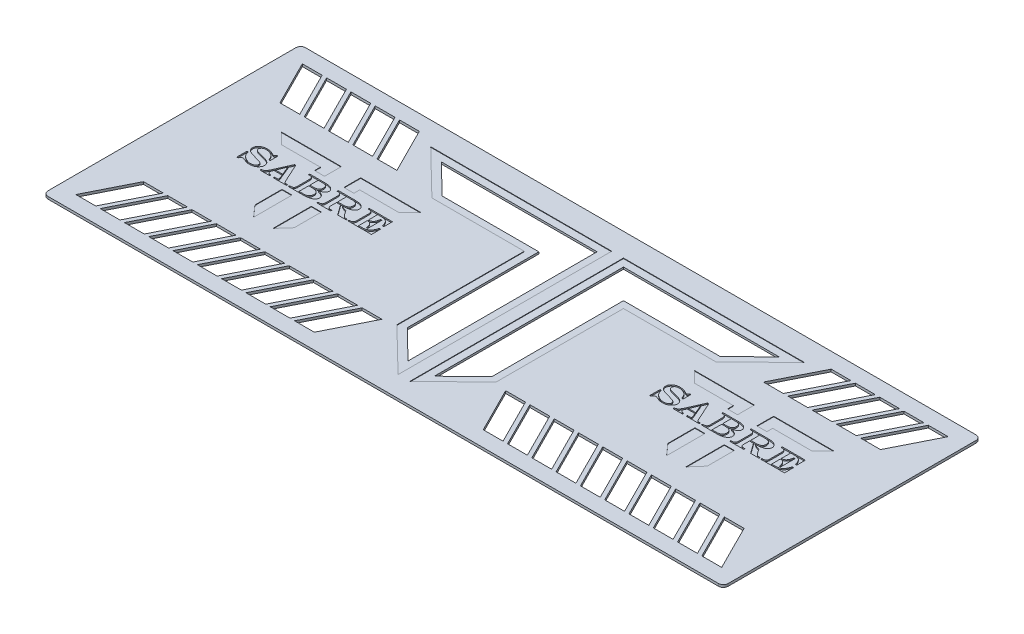
from build123d import *

# Parameters (mm, degrees)
SKETCH1_W           = 280
SKETCH1_H           = 106
BOSS_EXTRUDE1_DEPTH = 1
FILLET1_R           = 2
CUT_EXTRUDE1_START  = -0.5
CUT_EXTRUDE1_DEPTH  = 0.5
LPATTERN1_COUNT     = 2
LPATTERN1_PITCH     = 170
CUT_EXTRUDE2_DEPTH  = 1
CUT_EXTRUDE3_DEPTH  = 0.2
CUT_EXTRUDE4_DEPTH  = 0.2
CUT_EXTRUDE5_DEPTH  = 1


# Read off the part's stored shape, not the designer's step: Cut-Extrude1
with BuildPart() as part:
    # Sketch1 → Boss-Extrude1 (new body)
    with BuildSketch(Plane(origin=(0, 0, 0), x_dir=(1, 0, 0), z_dir=(0, 1, 0))):
        Rectangle(SKETCH1_W, SKETCH1_H)
    extrude(amount=BOSS_EXTRUDE1_DEPTH)

    # Fillet1
    fillet1_edges = [part.edges().sort_by_distance(p)[0] for p in [
        (-140, 0.5, -53),
        (140, 0.5, -53),
        (140, 0.5, 53),
        (-140, 0.5, 53),
    ]]
    fillet(fillet1_edges, radius=FILLET1_R)

    # Cut-Extrude1 outline → Cut-Extrude1 (cut)
    # profile 1 of 5: a face of its own
    with BuildSketch(Plane(origin=(0, 1, 0), x_dir=(1, 0, 0), z_dir=(0, 1, 0)).offset(CUT_EXTRUDE1_START)):
        with BuildLine():
            add(Edge.make_bspline(
                [(-106.17746632, 8.000768713), (-106.145436657, 8.002877246), (-106.081432034, 8.007090709), (-105.989368542, 8.043217945), (-105.903951635, 8.100887742), (-105.825090229, 8.181376258), (-105.752575803, 8.283783991), (-105.685428408, 8.407716897), (-105.626681677, 8.554887696), (-105.592757947, 8.661047453), (-105.574796476, 8.717255463)],
                knots=[0, 0, 0, 0, 0.095615682, 0.191068058, 0.291769804, 0.402365532, 0.526393257, 0.666376207, 0.823357453, 1, 1, 1, 1], degree=3))
            add(Edge.make_bspline(
                [(-106.791331271, 8.252658586), (-106.751620071, 8.232566304), (-106.676905456, 8.194763692), (-106.569734296, 8.144105729), (-106.475030396, 8.101534587), (-106.392563884, 8.065441605), (-106.321624886, 8.037374546), (-106.262815847, 8.016420153), (-106.215885923, 8.004136854), (-106.18870146, 8.001753667), (-106.17746632, 8.000768713)],
                knots=[0, 0, 0, 0, 0.200425727, 0.377090874, 0.533798689, 0.668043957, 0.782475738, 0.877256726, 0.949271104, 1, 1, 1, 1], degree=3))
            add(Edge.make_bspline(
                [(-109.823339004, 9.075498839), (-109.698843294, 9.072982106), (-109.448006616, 9.067911338), (-109.071678884, 9.026528515), (-108.693771902, 8.963979494), (-108.315088567, 8.873055465), (-107.934808536, 8.757744826), (-107.553228534, 8.614782269), (-107.170201992, 8.447014683), (-106.918807609, 8.318052406), (-106.791331271, 8.252658586)],
                knots=[0, 0, 0, 0, 0.117664495, 0.237072998, 0.357512053, 0.47958756, 0.604949098, 0.732946784, 0.864583425, 1, 1, 1, 1], degree=3))
            add(Edge.make_bspline(
                [(-113.262102235, 6.424124692), (-113.260506248, 6.486989147), (-113.257337483, 6.611803854), (-113.236933912, 6.796647021), (-113.201038024, 6.97615715), (-113.152537496, 7.150243497), (-113.090616573, 7.319521153), (-113.014308504, 7.483966342), (-112.921590044, 7.642733737), (-112.817948383, 7.797516049), (-112.700485911, 7.944690273), (-112.570769337, 8.082483965), (-112.432328098, 8.21467904), (-112.281368009, 8.336662791), (-112.120466803, 8.451562573), (-111.947984157, 8.5550332), (-111.766513978, 8.653694535), (-111.507168171, 8.76900699), (-111.166071546, 8.893862404), (-110.736287433, 8.998963158), (-110.286246275, 9.064852534), (-109.979681393, 9.071903154), (-109.823339004, 9.075498839)],
                knots=[0, 0, 0, 0, 0.038971493, 0.077376244, 0.115107398, 0.152338832, 0.189297768, 0.226728302, 0.264555857, 0.303159433, 0.342117573, 0.381127191, 0.420400756, 0.460685165, 0.501336906, 0.542862355, 0.585296084, 0.629298266, 0.718697782, 0.810057838, 0.903133029, 1, 1, 1, 1], degree=3))
            add(Edge.make_bspline(
                [(-112.857212587, 5.252370319), (-112.919502528, 5.341302903), (-113.041993357, 5.516185489), (-113.168384559, 5.807447711), (-113.246814723, 6.111513379), (-113.256969271, 6.319161717), (-113.262102235, 6.424124692)],
                knots=[0, 0, 0, 0, 0.257658078, 0.506674932, 0.750631924, 1, 1, 1, 1], degree=3))
            add(Edge.make_bspline(
                [(-111.207800381, 4.186969448), (-111.308804399, 4.225506907), (-111.500911414, 4.298804152), (-111.771038249, 4.413323202), (-112.005759391, 4.531277493), (-112.213304283, 4.647887874), (-112.396772773, 4.77549482), (-112.563393385, 4.918769347), (-112.719090354, 5.076743176), (-112.8110049, 5.193615664), (-112.857212587, 5.252370319)],
                knots=[0, 0, 0, 0, 0.162597773, 0.309256734, 0.441034827, 0.557526682, 0.667037542, 0.776516434, 0.887649353, 1, 1, 1, 1], degree=3))
            add(Edge.make_bspline(
                [(-109.250522773, 3.588031305), (-109.36431422, 3.619838501), (-109.582598995, 3.680853865), (-109.89681424, 3.767178616), (-110.181565483, 3.852421101), (-110.440338233, 3.927968472), (-110.670982293, 4.000576368), (-110.873957966, 4.068337028), (-111.050870417, 4.126830334), (-111.158173389, 4.167951261), (-111.207800381, 4.186969448)],
                knots=[0, 0, 0, 0, 0.17311511, 0.332084649, 0.477412506, 0.608598903, 0.727051977, 0.831656342, 0.92214205, 1, 1, 1, 1], degree=3))
            Line((-109.250522773, 3.588031305), (-108.632926121, 3.423836425))
            add(Edge.make_bspline(
                [(-106.328600244, 2.511435328), (-106.388553059, 2.563492991), (-106.518554848, 2.676374918), (-106.718225964, 2.781418153), (-106.90109941, 2.872530925), (-107.065475263, 2.939437603), (-107.248371304, 3.01134221), (-107.455287809, 3.082671874), (-107.693272056, 3.158020074), (-107.968366193, 3.242321333), (-108.286585003, 3.331271031), (-108.512825256, 3.391737481), (-108.632926121, 3.423836425)],
                knots=[0, 0, 0, 0, 0.095058532, 0.206125086, 0.269252981, 0.340546635, 0.419045255, 0.505254492, 0.603271131, 0.718797856, 0.850722316, 1, 1, 1, 1], degree=3))
            add(Edge.make_bspline(
                [(-105.987149527, 1.763229112), (-105.990692876, 1.831002763), (-105.997786932, 1.966690814), (-106.068928207, 2.162123203), (-106.175479105, 2.349373457), (-106.276338616, 2.456122147), (-106.328600244, 2.511435328)],
                knots=[0, 0, 0, 0, 0.239838849, 0.480175786, 0.730646522, 1, 1, 1, 1], degree=3))
            add(Edge.make_bspline(
                [(-108.019061171, 0.358243375), (-107.925032063, 0.360178707), (-107.740010042, 0.363986879), (-107.470151601, 0.400235493), (-107.213511019, 0.458424576), (-106.972436875, 0.537337747), (-106.75100623, 0.63752066), (-106.553246546, 0.754440186), (-106.383250778, 0.890260978), (-106.23974769, 1.041332704), (-106.12805021, 1.207731021), (-106.044846194, 1.383926047), (-105.997716973, 1.571109766), (-105.990686659, 1.698922992), (-105.987149527, 1.763229112)],
                knots=[0, 0, 0, 0, 0.102905249, 0.202487694, 0.297472894, 0.390713923, 0.479700354, 0.563083208, 0.641567444, 0.71720244, 0.790293303, 0.860063715, 0.929594457, 1, 1, 1, 1], degree=3))
            add(Edge.make_bspline(
                [(-111.77875076, 2.151326102), (-111.699914494, 2.065343867), (-111.540080634, 1.891022159), (-111.271150085, 1.652388665), (-110.981295724, 1.422719755), (-110.668151158, 1.211783786), (-110.34290088, 1.015767717), (-110.00797614, 0.847385831), (-109.671803532, 0.698243469), (-109.333166237, 0.576009836), (-108.99646247, 0.477144728), (-108.663891379, 0.412425293), (-108.339482913, 0.36484326), (-108.124960088, 0.360424628), (-108.019061171, 0.358243375)],
                knots=[0, 0, 0, 0, 0.081776267, 0.165794465, 0.25184825, 0.341026787, 0.430434453, 0.518036847, 0.603793757, 0.688252523, 0.77040959, 0.849636053, 0.925773031, 1, 1, 1, 1], degree=3))
            add(Edge.make_bspline(
                [(-112.59599346, 4.097408604), (-112.582159525, 4.002689945), (-112.554888771, 3.815971616), (-112.495598358, 3.542433483), (-112.416680293, 3.281636716), (-112.323053647, 3.031464713), (-112.213550659, 2.792743354), (-112.086230351, 2.566271951), (-111.94185754, 2.351701603), (-111.833286422, 2.218322769), (-111.77875076, 2.151326102)],
                knots=[0, 0, 0, 0, 0.134073388, 0.264298074, 0.391646335, 0.515443055, 0.638242392, 0.759173001, 0.879031733, 1, 1, 1, 1], degree=3))
            Line((-112.59599346, 4.097408604), (-113.152017032, 4.097408604))
            Line((-113.152017032, 4.097408604), (-113.152017032, -0.119414458))
            Line((-113.152017032, -0.119414458), (-112.607188565, -0.119414458))
            add(Edge.make_bspline(
                [(-111.666799705, 0.806047594), (-111.719859657, 0.803366984), (-111.823469237, 0.798132587), (-111.974741409, 0.761768959), (-112.115303186, 0.699384376), (-112.247501109, 0.612350872), (-112.368547463, 0.4905965), (-112.464500764, 0.323074105), (-112.549485835, 0.117568644), (-112.587026058, -0.036607746), (-112.607188565, -0.119414458)],
                knots=[0, 0, 0, 0, 0.109848072, 0.214499113, 0.320034099, 0.426842473, 0.540687667, 0.671896365, 0.823778573, 1, 1, 1, 1], degree=3))
            add(Edge.make_bspline(
                [(-110.474520972, 0.468328579), (-110.551409434, 0.500037753), (-110.694529193, 0.559061034), (-110.896488306, 0.632139688), (-111.065265438, 0.693984202), (-111.245953754, 0.746680503), (-111.44152737, 0.795690693), (-111.594350187, 0.802716726), (-111.666799705, 0.806047594)],
                knots=[0, 0, 0, 0, 0.200164531, 0.372585152, 0.516999432, 0.632577406, 0.825814033, 1, 1, 1, 1], degree=3))
            add(Edge.make_bspline(
                [(-108.047048935, -0.119414458), (-108.148481597, -0.11819611), (-108.348538042, -0.115793152), (-108.642493463, -0.090413374), (-108.925587003, -0.052243725), (-109.202927421, 0.005406581), (-109.488134874, 0.084535893), (-109.79322769, 0.188460664), (-110.126921543, 0.315021216), (-110.354946655, 0.415590797), (-110.474520972, 0.468328579)],
                knots=[0, 0, 0, 0, 0.120753913, 0.238163902, 0.35107058, 0.460731701, 0.575182342, 0.703288774, 0.844407304, 1, 1, 1, 1], degree=3))
            add(Edge.make_bspline(
                [(-105.177370231, 0.910535245), (-105.262521318, 0.828078956), (-105.433207954, 0.66279408), (-105.726880674, 0.453027248), (-106.049233888, 0.275925489), (-106.399535554, 0.13006291), (-106.776983097, 0.018702913), (-107.178625791, -0.060385941), (-107.604846985, -0.110102977), (-107.897018071, -0.116255247), (-108.047048935, -0.119414458)],
                knots=[0, 0, 0, 0, 0.113357576, 0.227226969, 0.34422936, 0.464878134, 0.589783684, 0.720342317, 0.856394812, 1, 1, 1, 1], degree=3))
            add(Edge.make_bspline(
                [(-104.416103059, 2.612191278), (-104.418774575, 2.538643159), (-104.424173238, 2.390015374), (-104.463834645, 2.166303958), (-104.525007957, 1.939758752), (-104.612921833, 1.713881874), (-104.722313929, 1.493532053), (-104.85081101, 1.28282304), (-105.002889015, 1.087382028), (-105.11893766, 0.969760028), (-105.177370231, 0.910535245)],
                knots=[0, 0, 0, 0, 0.11533341, 0.233068496, 0.355438412, 0.482999863, 0.612593659, 0.740943727, 0.869560528, 1, 1, 1, 1], degree=3))
            add(Edge.make_bspline(
                [(-105.141919064, 4.196298702), (-105.083132376, 4.138127892), (-104.968124578, 4.02432497), (-104.815318643, 3.841957898), (-104.692187265, 3.649395982), (-104.590580247, 3.452778839), (-104.510833636, 3.250497539), (-104.458131034, 3.042143885), (-104.422105989, 2.829251989), (-104.418119695, 2.68511107), (-104.416103059, 2.612191278)],
                knots=[0, 0, 0, 0, 0.138219231, 0.270406279, 0.396718167, 0.51947566, 0.639953373, 0.759231824, 0.878197213, 1, 1, 1, 1], degree=3))
            add(Edge.make_bspline(
                [(-107.991073407, 5.405370094), (-107.888996544, 5.378914954), (-107.691395429, 5.327702908), (-107.406228297, 5.248766396), (-107.140997833, 5.174494734), (-106.896562194, 5.102956682), (-106.674109449, 5.02870618), (-106.471702222, 4.960481212), (-106.289245043, 4.895951213), (-106.078636245, 4.809518012), (-105.839229163, 4.699461358), (-105.578314491, 4.549871606), (-105.344548063, 4.38469779), (-105.208440441, 4.258148521), (-105.141919064, 4.196298702)],
                knots=[0, 0, 0, 0, 0.101060651, 0.195633925, 0.283570652, 0.365043448, 0.439688609, 0.508301999, 0.569770025, 0.625115199, 0.726447956, 0.822045087, 0.913026136, 1, 1, 1, 1], degree=3))
            Line((-107.991073407, 5.405370094), (-108.476194645, 5.526650403))
            Line((-108.476194645, 5.526650403), (-108.787791747, 5.599418589))
            add(Edge.make_bspline(
                [(-109.073266937, 5.677784327), (-109.040999755, 5.667573999), (-108.982255569, 5.648985534), (-108.901651845, 5.627287961), (-108.839197041, 5.609518923), (-108.802758399, 5.602359301), (-108.787791747, 5.599418589)],
                knots=[0, 0, 0, 0, 0.342746122, 0.62398823, 0.845558529, 1, 1, 1, 1], degree=3))
            add(Edge.make_bspline(
                [(-111.37012941, 6.560331809), (-111.308787409, 6.506171455), (-111.179134143, 6.391697416), (-110.98517321, 6.27644248), (-110.803713608, 6.193270468), (-110.643943672, 6.127285955), (-110.463115887, 6.062830344), (-110.257699792, 5.996545029), (-110.01994979, 5.926593516), (-109.742911117, 5.850962405), (-109.422465142, 5.766870179), (-109.194585219, 5.708734493), (-109.073266937, 5.677784327)],
                knots=[0, 0, 0, 0, 0.098621157, 0.208446982, 0.27058147, 0.339592069, 0.417008968, 0.502239864, 0.600106632, 0.716123941, 0.848870602, 1, 1, 1, 1], degree=3))
            add(Edge.make_bspline(
                [(-111.623885134, 7.228306435), (-111.620678182, 7.161450397), (-111.614537356, 7.033431238), (-111.567212916, 6.851589891), (-111.487039418, 6.690724895), (-111.408921561, 6.603597807), (-111.37012941, 6.560331809)],
                knots=[0, 0, 0, 0, 0.273181187, 0.523100483, 0.763178887, 1, 1, 1, 1], degree=3))
            add(Edge.make_bspline(
                [(-111.261910057, 8.067939346), (-111.308531434, 8.013913637), (-111.407687147, 7.899010174), (-111.521843921, 7.694435264), (-111.606305758, 7.466963153), (-111.618107146, 7.306748113), (-111.623885134, 7.228306435)],
                knots=[0, 0, 0, 0, 0.228673321, 0.486349129, 0.74851527, 1, 1, 1, 1], degree=3))
            add(Edge.make_bspline(
                [(-109.83639996, 8.597841005), (-109.909222436, 8.596457117), (-110.050876467, 8.593765182), (-110.257626081, 8.571449741), (-110.451184605, 8.532532635), (-110.632717838, 8.478401494), (-110.80379866, 8.406355472), (-110.966258304, 8.31488994), (-111.120973484, 8.202058499), (-111.214349816, 8.113198991), (-111.261910057, 8.067939346)],
                knots=[0, 0, 0, 0, 0.13957811, 0.271506861, 0.398006454, 0.517573642, 0.634051402, 0.753100297, 0.874244264, 1, 1, 1, 1], degree=3))
            add(Edge.make_bspline(
                [(-106.46294151, 7.21711133), (-106.522742291, 7.283541231), (-106.644159959, 7.418418458), (-106.850878435, 7.602762549), (-107.080687658, 7.774997631), (-107.331055138, 7.93640734), (-107.601678957, 8.083644933), (-107.889870176, 8.214257433), (-108.194764224, 8.32816705), (-108.513486302, 8.423565431), (-108.840038673, 8.503287035), (-109.171495343, 8.555776949), (-109.503497897, 8.591501493), (-109.725599894, 8.59573102), (-109.83639996, 8.597841005)],
                knots=[0, 0, 0, 0, 0.071444271, 0.145058251, 0.221065176, 0.300954302, 0.38309134, 0.467237206, 0.553809308, 0.643191066, 0.733196278, 0.82241456, 0.911407917, 1, 1, 1, 1], degree=3))
            add(Edge.make_bspline(
                [(-105.571064774, 5.493065087), (-105.605584891, 5.585227494), (-105.672796217, 5.764669456), (-105.775991512, 6.024600685), (-105.885224653, 6.265372115), (-105.994303211, 6.490315151), (-106.108978971, 6.696493917), (-106.221424182, 6.888033802), (-106.339235796, 7.060269812), (-106.422565849, 7.165920647), (-106.46294151, 7.21711133)],
                knots=[0, 0, 0, 0, 0.151415398, 0.294808661, 0.43014741, 0.558099912, 0.679294196, 0.793016882, 0.89971109, 1, 1, 1, 1], degree=3))
            Line((-105.571064774, 5.493065087), (-105.029968009, 5.493065087))
            Line((-105.029968009, 5.493065087), (-105.029968009, 8.717255463))
            Line((-105.029968009, 8.717255463), (-105.574796476, 8.717255463))
        make_face()
    # profile 2 of 5: a face of its own
    with BuildSketch(Plane(origin=(0, 1, 0), x_dir=(1, 0, 0), z_dir=(0, 1, 0)).offset(CUT_EXTRUDE1_START)):
        with BuildLine():
            add(Edge.make_bspline(
                [(-94.590532153, 1.436705203), (-94.561384798, 1.376019374), (-94.505580421, 1.259832679), (-94.415035619, 1.099932497), (-94.322806366, 0.962519612), (-94.23188062, 0.845134406), (-94.137352013, 0.748811307), (-94.041504471, 0.6695629), (-93.944056296, 0.605358176), (-93.842728784, 0.555179827), (-93.734548299, 0.519750823), (-93.616810836, 0.495840353), (-93.488191647, 0.480970332), (-93.398295953, 0.478790148), (-93.351607147, 0.477657834)],
                knots=[0, 0, 0, 0, 0.12015059, 0.230035584, 0.327642723, 0.415374729, 0.494664926, 0.568012197, 0.636986209, 0.702524215, 0.769227226, 0.839554926, 0.916670216, 1, 1, 1, 1], degree=3))
            Line((-94.590532153, 1.436705203), (-98.089002614, 9.075498839))
            Line((-98.089002614, 9.075498839), (-98.574123852, 9.075498839))
            Line((-98.574123852, 9.075498839), (-101.363570966, 2.798776369))
            add(Edge.make_bspline(
                [(-102.606227674, 0.904937693), (-102.552348132, 0.949878678), (-102.439960308, 1.043621487), (-102.284417146, 1.212857033), (-102.126640081, 1.406973899), (-101.97370578, 1.632116158), (-101.817712682, 1.883051887), (-101.664269172, 2.162527667), (-101.510337613, 2.469920636), (-101.413713404, 2.686423675), (-101.363570966, 2.798776369)],
                knots=[0, 0, 0, 0, 0.092007693, 0.19191968, 0.301061643, 0.42018113, 0.548865169, 0.688823123, 0.838517001, 1, 1, 1, 1], degree=3))
            add(Edge.make_bspline(
                [(-103.76492109, 0.462731026), (-103.692099956, 0.47221376), (-103.556014446, 0.489934751), (-103.368498157, 0.521243672), (-103.213924749, 0.561676636), (-103.083283614, 0.602393705), (-102.967679299, 0.65922782), (-102.851794937, 0.726648474), (-102.730103877, 0.809617018), (-102.648819206, 0.872164218), (-102.606227674, 0.904937693)],
                knots=[0, 0, 0, 0, 0.174483929, 0.326069278, 0.4511396, 0.553933858, 0.650429054, 0.756361191, 0.872338166, 1, 1, 1, 1], degree=3))
            Line((-103.76492109, 0.462731026), (-103.76492109, 0))
            Line((-103.76492109, 0), (-99.783195243, 0))
            Line((-99.783195243, 0), (-99.783195243, 0.464596877))
            add(Edge.make_bspline(
                [(-100.604169645, 0.645584416), (-100.575017132, 0.629284066), (-100.520862559, 0.599004055), (-100.44490841, 0.559022319), (-100.37867593, 0.53087917), (-100.314584356, 0.507448349), (-100.23279695, 0.498972246), (-100.120084267, 0.483945997), (-99.965432327, 0.474974102), (-99.848483987, 0.46831465), (-99.783195243, 0.464596877)],
                knots=[0, 0, 0, 0, 0.117344028, 0.217981745, 0.301171929, 0.370257616, 0.456462603, 0.588432542, 0.770234256, 1, 1, 1, 1], degree=3))
            add(Edge.make_bspline(
                [(-101.137803006, 1.539327003), (-101.136371199, 1.491850812), (-101.133512036, 1.397045975), (-101.098985898, 1.258054521), (-101.049469538, 1.122434924), (-100.978439813, 0.996045612), (-100.895985413, 0.881114211), (-100.804109578, 0.78440618), (-100.708910044, 0.703021182), (-100.638482037, 0.664400392), (-100.604169645, 0.645584416)],
                knots=[0, 0, 0, 0, 0.130271983, 0.260139114, 0.391662667, 0.526394582, 0.657427873, 0.779635261, 0.892638715, 1, 1, 1, 1], degree=3))
            add(Edge.make_bspline(
                [(-100.895242387, 2.20730163), (-100.932671086, 2.153051921), (-101.004978785, 2.048248078), (-101.077858794, 1.878037109), (-101.129730367, 1.7096787), (-101.135132712, 1.595676486), (-101.137803006, 1.539327003)],
                knots=[0, 0, 0, 0, 0.273112951, 0.527621031, 0.76651058, 1, 1, 1, 1], degree=3))
            Line((-100.895242387, 2.20730163), (-100.675071979, 2.746532543))
            Line((-100.675071979, 2.746532543), (-97.411698733, 2.746532543))
            Line((-97.411698733, 2.746532543), (-97.30347938, 2.492776819))
            add(Edge.make_bspline(
                [(-97.172869816, 2.199838226), (-97.180392924, 2.21660514), (-97.198982427, 2.258035967), (-97.228498554, 2.328726702), (-97.26322332, 2.410210269), (-97.29018839, 2.465516545), (-97.30347938, 2.492776819)],
                knots=[0, 0, 0, 0, 0.171858908, 0.42466114, 0.716417441, 1, 1, 1, 1], degree=3))
            add(Edge.make_bspline(
                [(-96.715736343, 0.910535245), (-96.71712288, 0.937943914), (-96.720101371, 0.996821886), (-96.735474664, 1.09002265), (-96.762948812, 1.193004619), (-96.79188409, 1.287562661), (-96.82340342, 1.373474314), (-96.853669785, 1.453172704), (-96.890726054, 1.545088335), (-96.934135204, 1.650874761), (-96.984200528, 1.769810001), (-97.041977818, 1.901426888), (-97.106192782, 2.045999847), (-97.149940763, 2.146935928), (-97.172869816, 2.199838226)],
                knots=[0, 0, 0, 0, 0.059856004, 0.128579766, 0.205606819, 0.29231986, 0.344267609, 0.405266733, 0.478354874, 0.560519505, 0.654794512, 0.759941277, 0.874181185, 1, 1, 1, 1], degree=3))
            add(Edge.make_bspline(
                [(-97.504991279, 0.477657834), (-97.437146504, 0.478994396), (-97.312286743, 0.481454171), (-97.141389189, 0.500914325), (-97.00294886, 0.533179952), (-96.893095721, 0.578612996), (-96.813178098, 0.643706714), (-96.754231465, 0.719557114), (-96.721948852, 0.811787781), (-96.717863991, 0.876716399), (-96.715736343, 0.910535245)],
                knots=[0, 0, 0, 0, 0.20043166, 0.368869217, 0.507030732, 0.619724333, 0.716437918, 0.808317201, 0.900159725, 1, 1, 1, 1], degree=3))
            Line((-97.504991279, 0.477657834), (-98.256929197, 0.477657834))
            Line((-98.256929197, 0.477657834), (-98.256929197, 0))
            Line((-98.256929197, 0), (-92.885144419, 0))
            Line((-92.885144419, 0), (-92.885144419, 0.477657834))
            Line((-92.885144419, 0.477657834), (-93.351607147, 0.477657834))
        make_face()
        Polygon((-99.074171896, 6.806624129), (-97.600149675, 3.224190377), (-100.51274295, 3.224190377), align=None, mode=Mode.SUBTRACT)
    # profile 3 of 5: a face of its own
    with BuildSketch(Plane(origin=(0, 1, 0), x_dir=(1, 0, 0), z_dir=(0, 1, 0)).offset(CUT_EXTRUDE1_START)):
        with BuildLine():
            add(Edge.make_bspline(
                [(-85.645642879, 8.836669922), (-85.51870728, 8.834999659), (-85.26510462, 8.831662667), (-84.887612458, 8.80095368), (-84.513825862, 8.75071204), (-84.151893475, 8.679866307), (-83.811158328, 8.600116057), (-83.509398736, 8.50243543), (-83.247309728, 8.399965245), (-83.096596834, 8.311089379), (-83.025988197, 8.269451244)],
                knots=[0, 0, 0, 0, 0.140578652, 0.280859905, 0.419207913, 0.558100284, 0.689263726, 0.806474648, 0.909333828, 1, 1, 1, 1], degree=3))
            Line((-85.645642879, 8.836669922), (-92.090291931, 8.836669922))
            Line((-92.090291931, 8.836669922), (-92.090291931, 8.359012088))
            Line((-92.090291931, 8.359012088), (-91.717121748, 8.359012088))
            add(Edge.make_bspline(
                [(-90.267355589, 6.907380078), (-90.268372168, 6.967745208), (-90.270336217, 7.084371667), (-90.286972146, 7.252878739), (-90.315580538, 7.408540864), (-90.351480243, 7.553610569), (-90.402184542, 7.68510133), (-90.461805843, 7.8056902), (-90.535789783, 7.911454326), (-90.617358857, 8.009010833), (-90.714917267, 8.090565825), (-90.820659043, 8.164609873), (-90.940817505, 8.223736086), (-91.071360307, 8.27526736), (-91.216568299, 8.310954147), (-91.372895622, 8.339215272), (-91.541371727, 8.35600191), (-91.657377703, 8.357988815), (-91.717121748, 8.359012088)],
                knots=[0, 0, 0, 0, 0.076539303, 0.147875237, 0.214396745, 0.277140818, 0.337049955, 0.392779557, 0.447250432, 0.500374282, 0.553498133, 0.607969008, 0.66369861, 0.722871227, 0.7856153, 0.85291307, 0.924249004, 1, 1, 1, 1], degree=3))
            Line((-90.267355589, 6.907380078), (-90.267355589, 1.918094738))
            add(Edge.make_bspline(
                [(-91.717121748, 0.477657834), (-91.656738606, 0.478584768), (-91.540077347, 0.480375621), (-91.371918779, 0.498204581), (-91.21537218, 0.522677019), (-91.072136712, 0.562609781), (-90.939870133, 0.610753968), (-90.819944065, 0.670268256), (-90.71247362, 0.741447434), (-90.618085955, 0.824695646), (-90.535070723, 0.919571415), (-90.461892833, 1.025486772), (-90.402567157, 1.145479793), (-90.35144404, 1.275544581), (-90.315351132, 1.419367575), (-90.287007545, 1.574469159), (-90.27038896, 1.742347334), (-90.268386746, 1.858351582), (-90.267355589, 1.918094738)],
                knots=[0, 0, 0, 0, 0.076801524, 0.148381853, 0.214995072, 0.278157703, 0.337252858, 0.393880108, 0.448094647, 0.500803828, 0.553513008, 0.608170498, 0.664091028, 0.723466369, 0.785659746, 0.852409155, 0.923989484, 1, 1, 1, 1], degree=3))
            Line((-91.717121748, 0.477657834), (-92.090291931, 0.477657834))
            Line((-92.090291931, 0.477657834), (-92.090291931, 0))
            Line((-92.090291931, 0), (-85.654972133, 0))
            add(Edge.make_bspline(
                [(-81.550100126, 2.33044779), (-81.551357976, 2.274379978), (-81.553857848, 2.162949988), (-81.579281501, 1.998656987), (-81.618682194, 1.83883649), (-81.672377069, 1.683312915), (-81.744295622, 1.53286882), (-81.832769225, 1.387383125), (-81.935257719, 1.245328271), (-82.053587175, 1.10898093), (-82.185305795, 0.978575715), (-82.332830121, 0.856785415), (-82.492172157, 0.741750196), (-82.665482315, 0.634456376), (-82.851845233, 0.536693409), (-83.050772669, 0.444258077), (-83.263526451, 0.361077179), (-83.568576737, 0.25742504), (-83.978829843, 0.153358074), (-84.502955556, 0.064891807), (-85.066078719, 0.010250947), (-85.454576817, 0.003488308), (-85.654972133, 0)],
                knots=[0, 0, 0, 0, 0.032217082, 0.064028701, 0.095339893, 0.126781514, 0.158454134, 0.191020629, 0.224569754, 0.259053144, 0.294708947, 0.331018714, 0.368932604, 0.407636016, 0.448109706, 0.489871064, 0.533700371, 0.579388343, 0.675059427, 0.776652178, 0.884792596, 1, 1, 1, 1], degree=3))
            add(Edge.make_bspline(
                [(-83.160329463, 4.33437167), (-83.033501567, 4.271940769), (-82.790220792, 4.152186059), (-82.458851523, 3.943929653), (-82.180948783, 3.715178609), (-81.950046342, 3.472526746), (-81.769814704, 3.211862169), (-81.643581946, 2.932385025), (-81.562416333, 2.63727428), (-81.554240664, 2.4335986), (-81.550100126, 2.33044779)],
                knots=[0, 0, 0, 0, 0.155488387, 0.298257217, 0.429520132, 0.550562166, 0.665784018, 0.776342628, 0.886729535, 1, 1, 1, 1], degree=3))
            add(Edge.make_bspline(
                [(-84.297208127, 4.683661814), (-84.244029202, 4.672239514), (-84.075368567, 4.634635918), (-83.798054367, 4.559841599), (-83.470993231, 4.457227385), (-83.26251032, 4.374780316), (-83.160329463, 4.33437167)],
                knots=[0.149310098, 0.149310098, 0.149310098, 0.149310098, 0.265875759, 0.519676663, 0.764585741, 1, 1, 1, 1], degree=3))
            add(Edge.make_bspline(
                [(-82.845000659, 5.269162977), (-82.953176662, 5.203351432), (-83.178467263, 5.066290327), (-83.490260317, 4.929499707), (-83.771183115, 4.829724932), (-84.016585857, 4.755373196), (-84.195682487, 4.708641406), (-84.29266196, 4.684777483), (-84.297208127, 4.683661814)],
                knots=[0, 0, 0, 0, 0.202346321, 0.421412541, 0.542857817, 0.679105166, 0.831349055, 0.838835715, 0.838835715, 0.838835715, 0.838835715], degree=3))
            add(Edge.make_bspline(
                [(-81.936331264, 6.646160951), (-81.939522496, 6.583141019), (-81.945908068, 6.457039792), (-81.987894569, 6.270396871), (-82.059708375, 6.089128318), (-82.163114863, 5.915204126), (-82.290893382, 5.743449081), (-82.449035526, 5.578111393), (-82.634420359, 5.416699894), (-82.77312923, 5.319517588), (-82.845000659, 5.269162977)],
                knots=[0, 0, 0, 0, 0.109929113, 0.219965266, 0.331989465, 0.448672057, 0.571929244, 0.704713218, 0.846998374, 1, 1, 1, 1], degree=3))
            add(Edge.make_bspline(
                [(-83.025988197, 8.269451244), (-82.939627138, 8.214522437), (-82.772651403, 8.108319732), (-82.548728504, 7.926727162), (-82.360446587, 7.731535904), (-82.206341122, 7.525736602), (-82.086754644, 7.312675376), (-81.998030344, 7.095170909), (-81.946408787, 6.871860554), (-81.939674809, 6.721044107), (-81.936331264, 6.646160951)],
                knots=[0, 0, 0, 0, 0.150004103, 0.290027075, 0.421615638, 0.546749676, 0.665988022, 0.778953655, 0.890246399, 1, 1, 1, 1], degree=3))
        make_face()
        with BuildLine():
            add(Edge.make_bspline(
                [(-84.440303189, 3.735433527), (-84.507075134, 3.796579263), (-84.640619023, 3.918870734), (-84.871938907, 4.066134835), (-85.12429522, 4.184353477), (-85.352017069, 4.258253116), (-85.550128081, 4.305538072), (-85.717366745, 4.334007202), (-85.901497544, 4.360402375), (-86.102440919, 4.382742189), (-86.320877995, 4.399348023), (-86.556724435, 4.40971152), (-86.809255233, 4.417890832), (-86.983450469, 4.418184144), (-87.073018827, 4.418334961)],
                knots=[0, 0, 0, 0, 0.097071364, 0.194142728, 0.293035049, 0.395678849, 0.450594766, 0.511645654, 0.577761538, 0.650335519, 0.728707305, 0.812954443, 0.903824216, 1, 1, 1, 1], degree=3))
            add(Edge.make_bspline(
                [(-83.938389294, 2.447996397), (-83.939559693, 2.514008924), (-83.941842743, 2.64277678), (-83.967308825, 2.830652076), (-84.005958423, 3.008088416), (-84.059530195, 3.175650503), (-84.131762157, 3.331363789), (-84.217176004, 3.478047316), (-84.320738794, 3.613390272), (-84.4002504, 3.694550346), (-84.440303189, 3.735433527)],
                knots=[0, 0, 0, 0, 0.13916537, 0.271464029, 0.399107782, 0.521913317, 0.641674757, 0.760476618, 0.879343657, 1, 1, 1, 1], degree=3))
            add(Edge.make_bspline(
                [(-86.391983244, 0.453401772), (-86.294907033, 0.45462007), (-86.106028326, 0.456990481), (-85.831692775, 0.481450655), (-85.574691241, 0.522058399), (-85.336217542, 0.579263864), (-85.116102, 0.652780047), (-84.912693664, 0.739011732), (-84.729337553, 0.847018012), (-84.56224843, 0.967974365), (-84.413708155, 1.10452633), (-84.286211401, 1.256574953), (-84.179155699, 1.422409879), (-84.091221665, 1.600909587), (-84.021090264, 1.792707871), (-83.974088284, 1.999006217), (-83.94272899, 2.218779544), (-83.939863397, 2.370136268), (-83.938389294, 2.447996397)],
                knots=[0, 0, 0, 0, 0.080953835, 0.157509813, 0.229491051, 0.297812531, 0.361791128, 0.422893111, 0.48170598, 0.538878422, 0.594678755, 0.649542836, 0.703933984, 0.758918109, 0.815205832, 0.873842267, 0.935102603, 1, 1, 1, 1], degree=3))
            Line((-86.391983244, 0.453401772), (-88.117895338, 0.453401772))
            Line((-88.117895338, 0.453401772), (-88.117895338, 4.418334961))
            Line((-88.117895338, 4.418334961), (-87.073018827, 4.418334961))
        make_face(mode=Mode.SUBTRACT)
        with BuildLine():
            add(Edge.make_bspline(
                [(-84.240657141, 6.743185198), (-84.242235683, 6.809770973), (-84.24529736, 6.938918102), (-84.264723344, 7.126610319), (-84.302673232, 7.299969216), (-84.352334471, 7.460597045), (-84.41845329, 7.606600871), (-84.496577432, 7.7413693), (-84.592269243, 7.860649569), (-84.702514328, 7.966538765), (-84.826476341, 8.060935808), (-84.96780817, 8.141305395), (-85.126028684, 8.207868245), (-85.300034821, 8.264224562), (-85.491412069, 8.306003693), (-85.698246747, 8.337724703), (-85.922062307, 8.356530729), (-86.076617635, 8.3581639), (-86.156886029, 8.359012088)],
                knots=[0, 0, 0, 0, 0.069254583, 0.134323443, 0.195849882, 0.253533737, 0.308829323, 0.362184376, 0.415114344, 0.467260004, 0.520814618, 0.576730867, 0.635840291, 0.69904369, 0.766672409, 0.839302908, 0.916541879, 1, 1, 1, 1], degree=3))
            add(Edge.make_bspline(
                [(-86.459153876, 4.895992795), (-86.369567922, 4.897589067), (-86.195749283, 4.900686226), (-85.943618351, 4.919814907), (-85.709498788, 4.958173881), (-85.491907158, 5.007249259), (-85.291777083, 5.073110001), (-85.107842262, 5.150508297), (-84.941311959, 5.244313873), (-84.794568184, 5.354755433), (-84.662798613, 5.477832903), (-84.549169244, 5.615742448), (-84.453184492, 5.768970396), (-84.374091273, 5.935941171), (-84.315282001, 6.11810432), (-84.272375894, 6.313654553), (-84.246005152, 6.523546535), (-84.242476328, 6.668472612), (-84.240657141, 6.743185198)],
                knots=[0, 0, 0, 0, 0.081356834, 0.157852135, 0.229345062, 0.296608449, 0.360188505, 0.4204037, 0.477564572, 0.533250039, 0.586786205, 0.640947265, 0.695005169, 0.750584572, 0.808270338, 0.868424587, 0.932169976, 1, 1, 1, 1], degree=3))
            Line((-86.459153876, 4.895992795), (-88.117895338, 4.895992795))
            Line((-88.117895338, 4.895992795), (-88.117895338, 8.359012088))
            Line((-88.117895338, 8.359012088), (-86.156886029, 8.359012088))
        make_face(mode=Mode.SUBTRACT)
    # profile 4 of 5: a face of its own
    with BuildSketch(Plane(origin=(0, 1, 0), x_dir=(1, 0, 0), z_dir=(0, 1, 0)).offset(CUT_EXTRUDE1_START)):
        with BuildLine():
            add(Edge.make_bspline(
                [(-76.415278414, 1.910631334), (-76.414125326, 1.848406034), (-76.411907874, 1.728743269), (-76.397249087, 1.555986688), (-76.371955881, 1.397277397), (-76.334076969, 1.252685205), (-76.288155883, 1.120862157), (-76.230144474, 1.002278222), (-76.161193072, 0.897545916), (-76.081944102, 0.805901852), (-75.990525027, 0.729523163), (-75.890851612, 0.661359692), (-75.780668475, 0.603786183), (-75.659993304, 0.55656807), (-75.528915513, 0.522250423), (-75.388125708, 0.495440959), (-75.236972079, 0.481236883), (-75.132842398, 0.478872773), (-75.079329161, 0.477657834)],
                knots=[0, 0, 0, 0, 0.082520417, 0.158691418, 0.22974685, 0.295366456, 0.356676582, 0.414591378, 0.469953594, 0.522562169, 0.574631289, 0.62747857, 0.682452318, 0.739126214, 0.798953626, 0.86188466, 0.929021209, 1, 1, 1, 1], degree=3))
            Line((-76.415278414, 1.910631334), (-76.415278414, 4.179506044))
            Line((-76.415278414, 4.179506044), (-74.77146376, 4.179506044))
            Line((-74.77146376, 4.179506044), (-71.776773046, 0))
            Line((-71.776773046, 0), (-68.257778224, 0))
            Line((-68.257778224, 0), (-68.257778224, 0.477657834))
            Line((-68.257778224, 0.477657834), (-68.737301909, 0.477657834))
            add(Edge.make_bspline(
                [(-69.715007787, 0.69596239), (-69.653823137, 0.661934653), (-69.524193435, 0.589841317), (-69.294415993, 0.52405398), (-69.028634338, 0.483470199), (-68.838242616, 0.479671699), (-68.737301909, 0.477657834)],
                knots=[0, 0, 0, 0, 0.206473268, 0.43744743, 0.701749352, 1, 1, 1, 1], degree=3))
            add(Edge.make_bspline(
                [(-70.847579291, 2.121472488), (-70.786631045, 2.029612611), (-70.669954651, 1.853760477), (-70.492729906, 1.608335083), (-70.33189717, 1.384821836), (-70.179143765, 1.190163646), (-70.041117712, 1.022683352), (-69.917235866, 0.887017715), (-69.814136223, 0.777470542), (-69.745361247, 0.72092046), (-69.715007787, 0.69596239)],
                knots=[0, 0, 0, 0, 0.181120289, 0.346727978, 0.497375848, 0.633526611, 0.753252842, 0.8538262, 0.935486991, 1, 1, 1, 1], degree=3))
            add(Edge.make_bspline(
                [(-71.375615099, 2.897666467), (-71.343868457, 2.851661059), (-71.285177968, 2.766610175), (-71.203461832, 2.647355647), (-71.135938423, 2.545996255), (-71.058175222, 2.432614181), (-70.96384881, 2.293154557), (-70.888012355, 2.181175428), (-70.847579291, 2.121472488)],
                knots=[0, 0, 0, 0, 0.178623159, 0.330223293, 0.461970904, 0.567814805, 0.769575573, 1, 1, 1, 1], degree=3))
            Line((-71.375615099, 2.897666467), (-71.590187954, 3.224190377))
            add(Edge.make_bspline(
                [(-73.981104195, 4.179977217), (-73.912206822, 4.137500182), (-73.715001145, 4.017801701), (-73.386487722, 3.836193648), (-72.991232251, 3.650344625), (-72.655526864, 3.515595969), (-72.369938488, 3.424046097), (-72.132312365, 3.355391437), (-71.869581313, 3.288220548), (-71.686066851, 3.246163491), (-71.590187954, 3.224190377)],
                knots=[0.082249325, 0.082249325, 0.082249325, 0.082249325, 0.168304452, 0.327528884, 0.481054288, 0.632463067, 0.711719524, 0.799828005, 0.895418216, 1, 1, 1, 1], degree=3))
            add(Edge.make_bspline(
                [(-72.903746997, 4.218688913), (-72.990799273, 4.212734995), (-73.177849829, 4.199941719), (-73.477702508, 4.187365396), (-73.749826849, 4.181444788), (-73.921763248, 4.180235998), (-73.981104195, 4.179977217)],
                knots=[0, 0, 0, 0, 0.205254569, 0.441033626, 0.705916483, 0.845511825, 0.845511825, 0.845511825, 0.845511825], degree=3))
            add(Edge.make_bspline(
                [(-70.494933469, 4.819492907), (-70.562837038, 4.785385352), (-70.70891847, 4.712009525), (-70.954112153, 4.619984193), (-71.235357598, 4.52801389), (-71.658467828, 4.412866343), (-72.21756624, 4.295478075), (-72.674956265, 4.244292442), (-72.903746997, 4.218688913)],
                knots=[0, 0, 0, 0, 0.091291063, 0.196395113, 0.314376202, 0.446967289, 0.72336791, 1, 1, 1, 1], degree=3))
            add(Edge.make_bspline(
                [(-69.369825368, 6.493161176), (-69.372646334, 6.410735835), (-69.378244824, 6.247154497), (-69.435637914, 6.008494441), (-69.5232968, 5.779842144), (-69.648591236, 5.563236894), (-69.809245982, 5.35912402), (-70.004261467, 5.16531816), (-70.234242279, 4.982422177), (-70.406085137, 4.875022186), (-70.494933469, 4.819492907)],
                knots=[0, 0, 0, 0, 0.116621788, 0.231447609, 0.345866725, 0.462741403, 0.584579617, 0.71297543, 0.851598986, 1, 1, 1, 1], degree=3))
            add(Edge.make_bspline(
                [(-70.015409784, 7.926134677), (-69.963905694, 7.872383677), (-69.86262033, 7.766679651), (-69.732455268, 7.593931469), (-69.620523031, 7.415069728), (-69.530120415, 7.229657445), (-69.459167998, 7.042084895), (-69.409219298, 6.856381874), (-69.374364021, 6.674211522), (-69.371326033, 6.553023842), (-69.369825368, 6.493161176)],
                knots=[0, 0, 0, 0, 0.138504915, 0.272376833, 0.401880022, 0.530838413, 0.655804163, 0.774636719, 0.888678067, 1, 1, 1, 1], degree=3))
            add(Edge.make_bspline(
                [(-73.575453325, 8.836669922), (-73.462253095, 8.835809047), (-73.240790331, 8.834124847), (-72.917264161, 8.825237164), (-72.610498564, 8.808748875), (-72.321895408, 8.784137587), (-72.049815508, 8.755044434), (-71.795408767, 8.71750354), (-71.557375978, 8.675376414), (-71.335783512, 8.624616343), (-71.128349921, 8.566982545), (-70.93309879, 8.501748277), (-70.750124518, 8.427686092), (-70.579867676, 8.343006992), (-70.42088014, 8.251539933), (-70.272671356, 8.153203101), (-70.137689216, 8.044523612), (-70.055886272, 7.965323347), (-70.015409784, 7.926134677)],
                knots=[0, 0, 0, 0, 0.090152612, 0.176372843, 0.257726584, 0.334769825, 0.407026291, 0.475603599, 0.539531748, 0.599489312, 0.656573055, 0.710924611, 0.763353089, 0.813636621, 0.862232969, 0.909352937, 0.955147399, 1, 1, 1, 1], degree=3))
            Line((-73.575453325, 8.836669922), (-80.369016498, 8.836669922))
            Line((-80.369016498, 8.836669922), (-80.369016498, 8.359012088))
            Line((-80.369016498, 8.359012088), (-80.014504824, 8.359012088))
            add(Edge.make_bspline(
                [(-78.564738665, 6.916709333), (-78.565667965, 6.977091526), (-78.567463387, 7.093750951), (-78.585260596, 7.26192226), (-78.609842057, 7.418425112), (-78.649246376, 7.56124762), (-78.698388428, 7.692481177), (-78.756724088, 7.811802601), (-78.829150754, 7.917848043), (-78.91177499, 8.011948208), (-79.006114555, 8.095229943), (-79.113598579, 8.166398532), (-79.233519924, 8.2259209), (-79.365791313, 8.274042419), (-79.509603093, 8.314230407), (-79.667455193, 8.338412245), (-79.836842862, 8.356238496), (-79.954122224, 8.358069417), (-80.014504824, 8.359012088)],
                knots=[0, 0, 0, 0, 0.076665231, 0.148118534, 0.21461354, 0.277664082, 0.335914464, 0.392441223, 0.445904041, 0.498519684, 0.551135326, 0.605253656, 0.661780415, 0.7207707, 0.783821242, 0.851095359, 0.923334769, 1, 1, 1, 1], degree=3))
            Line((-78.564738665, 6.916709333), (-78.564738665, 1.919960589))
            add(Edge.make_bspline(
                [(-80.014504824, 0.477657834), (-79.954121684, 0.478584768), (-79.837460426, 0.480375622), (-79.669301846, 0.498204576), (-79.512755287, 0.522677035), (-79.369519681, 0.562609727), (-79.237253575, 0.61075415), (-79.117325862, 0.670267617), (-79.009861201, 0.741449683), (-78.915452716, 0.824687498), (-78.832515705, 0.919602329), (-78.758714929, 1.025823205), (-78.700461458, 1.146982453), (-78.648738808, 1.27736603), (-78.612760234, 1.421246512), (-78.584382912, 1.576331133), (-78.567774163, 1.744214254), (-78.565770545, 1.860217797), (-78.564738665, 1.919960589)],
                knots=[0, 0, 0, 0, 0.076747285, 0.148277062, 0.214843238, 0.277961262, 0.337014683, 0.393601942, 0.447778193, 0.500450149, 0.553122105, 0.607740995, 0.664328254, 0.723661663, 0.785811118, 0.852513387, 0.924043164, 1, 1, 1, 1], degree=3))
            Line((-80.014504824, 0.477657834), (-80.369016498, 0.477657834))
            Line((-80.369016498, 0.477657834), (-80.369016498, 0))
            Line((-80.369016498, 0), (-74.58674452, 0))
            Line((-74.58674452, 0), (-74.58674452, 0.477657834))
            Line((-74.58674452, 0.477657834), (-75.079329161, 0.477657834))
        make_face()
        with BuildLine():
            add(Edge.make_bspline(
                [(-71.758114536, 6.517417238), (-71.759756161, 6.59214696), (-71.762928763, 6.736569512), (-71.791593997, 6.945978829), (-71.837998639, 7.141152464), (-71.902505782, 7.322656625), (-71.987802589, 7.48911235), (-72.091278759, 7.641291715), (-72.212429257, 7.780378227), (-72.355184421, 7.902803026), (-72.515727053, 8.010693194), (-72.695070616, 8.103998981), (-72.891267448, 8.18509071), (-73.107606809, 8.247074421), (-73.341996312, 8.297382167), (-73.594938697, 8.334864548), (-73.866836192, 8.354408048), (-74.053704927, 8.357444947), (-74.150135406, 8.359012088)],
                knots=[0, 0, 0, 0, 0.065027747, 0.125672528, 0.183585091, 0.239417854, 0.292931661, 0.345941869, 0.399269102, 0.453004307, 0.509166871, 0.567291643, 0.628724052, 0.693652547, 0.762891866, 0.837318047, 0.916050704, 1, 1, 1, 1], degree=3))
            add(Edge.make_bspline(
                [(-74.187452425, 4.657163878), (-74.051142888, 4.659494675), (-73.792268547, 4.663921244), (-73.424190453, 4.701497624), (-73.096702822, 4.760300436), (-72.808186482, 4.84809304), (-72.557298683, 4.9625074), (-72.338989302, 5.100288639), (-72.15675892, 5.267304821), (-72.008013079, 5.460766981), (-71.895945559, 5.68416602), (-71.81248668, 5.935117096), (-71.768046355, 6.21732395), (-71.761515538, 6.414654809), (-71.758114536, 6.517417238)],
                knots=[0, 0, 0, 0, 0.116306649, 0.220885551, 0.315414364, 0.399866473, 0.477535349, 0.550124398, 0.619252019, 0.687410936, 0.757205826, 0.831566535, 0.912286239, 1, 1, 1, 1], degree=3))
            Line((-74.187452425, 4.657163878), (-76.415278414, 4.657163878))
            Line((-76.415278414, 4.657163878), (-76.415278414, 8.359012088))
            Line((-76.415278414, 8.359012088), (-74.150135406, 8.359012088))
        make_face(mode=Mode.SUBTRACT)
    # profile 5 of 5: a face of its own
    with BuildSketch(Plane(origin=(0, 1, 0), x_dir=(1, 0, 0), z_dir=(0, 1, 0)).offset(CUT_EXTRUDE1_START)):
        with BuildLine():
            add(Edge.make_bspline(
                [(-58.59826805, 5.287821486), (-58.620454061, 5.36376014), (-58.663273001, 5.510321534), (-58.728475001, 5.721223672), (-58.792125181, 5.915020074), (-58.851953227, 6.092234941), (-58.907234688, 6.25404646), (-58.962996765, 6.398025991), (-59.015940659, 6.525875815), (-59.079752126, 6.676095869), (-59.169313792, 6.849597892), (-59.289565137, 7.049814602), (-59.423014268, 7.246909101), (-59.524601481, 7.370865524), (-59.575973928, 7.433550036)],
                knots=[0, 0, 0, 0, 0.099810661, 0.192634304, 0.278490378, 0.3571495, 0.428619214, 0.494194439, 0.551898452, 0.603208984, 0.700064232, 0.797896706, 0.897796774, 1, 1, 1, 1], degree=3))
            Line((-58.59826805, 5.287821486), (-58.081427347, 5.287821486))
            Line((-58.081427347, 5.287821486), (-58.081427347, 8.836669922))
            Line((-58.081427347, 8.836669922), (-67.5935353, 8.836669922))
            Line((-67.5935353, 8.836669922), (-67.5935353, 8.359012088))
            Line((-67.5935353, 8.359012088), (-67.239023626, 8.359012088))
            add(Edge.make_bspline(
                [(-65.787391616, 6.918575184), (-65.788319569, 6.978958065), (-65.790112391, 7.095618821), (-65.807927672, 7.263780886), (-65.832447081, 7.42031548), (-65.872062974, 7.563029757), (-65.920585463, 7.694894778), (-65.981607579, 7.813162877), (-66.053515495, 7.919812251), (-66.136407542, 8.013682739), (-66.230071121, 8.097300809), (-66.338686576, 8.166237856), (-66.458398711, 8.225440656), (-66.58957497, 8.27698454), (-66.734525271, 8.313396322), (-66.891901386, 8.338666627), (-67.061381689, 8.356168338), (-67.178647832, 8.358045573), (-67.239023626, 8.359012088)],
                knots=[0, 0, 0, 0, 0.076665235, 0.148118541, 0.214613551, 0.277664096, 0.33591448, 0.392798923, 0.446261744, 0.498877389, 0.551493034, 0.605177185, 0.661703947, 0.720973924, 0.783821231, 0.851095351, 0.923334765, 1, 1, 1, 1], degree=3))
            Line((-65.787391616, 6.918575184), (-65.787391616, 1.929289844))
            add(Edge.make_bspline(
                [(-67.239023626, 0.477657834), (-67.18051247, 0.478644562), (-67.066967205, 0.480559381), (-66.902346875, 0.497817106), (-66.748339869, 0.524575013), (-66.606472835, 0.566608658), (-66.47476558, 0.616386249), (-66.35388641, 0.67795698), (-66.24535382, 0.75330862), (-66.148031043, 0.838927479), (-66.062543292, 0.936343119), (-65.987689969, 1.044152604), (-65.926120256, 1.165031804), (-65.876342376, 1.29673905), (-65.834308814, 1.438606086), (-65.807550883, 1.592613092), (-65.790293165, 1.757233422), (-65.788378345, 1.870778687), (-65.787391616, 1.929289844)],
                knots=[0, 0, 0, 0, 0.074499557, 0.14457195, 0.210605695, 0.273280349, 0.332712356, 0.389752308, 0.445563418, 0.500559063, 0.554436582, 0.610247692, 0.667287644, 0.726719651, 0.789394305, 0.85542805, 0.925500443, 1, 1, 1, 1], degree=3))
            Line((-67.239023626, 0.477657834), (-67.5935353, 0.477657834))
            Line((-67.5935353, 0.477657834), (-67.57487679, 0))
            Line((-67.57487679, 0), (-57.853793536, 0))
            Line((-57.853793536, 0), (-57.853793536, 3.76155544))
            Line((-57.853793536, 3.76155544), (-58.411682959, 3.76155544))
            add(Edge.make_bspline(
                [(-58.833365265, 2.517032881), (-58.800470786, 2.596422743), (-58.728561351, 2.769974059), (-58.624785883, 3.056583054), (-58.519499985, 3.392921288), (-58.449192443, 3.633307822), (-58.411682959, 3.76155544)],
                knots=[0, 0, 0, 0, 0.196047636, 0.428572669, 0.695140184, 1, 1, 1, 1], degree=3))
            add(Edge.make_bspline(
                [(-59.740168809, 1.296766384), (-59.645937786, 1.381688091), (-59.457483689, 1.551524342), (-59.213804393, 1.845334241), (-59.001215301, 2.166725), (-58.889793583, 2.39926535), (-58.833365265, 2.517032881)],
                knots=[0, 0, 0, 0, 0.247963268, 0.495905625, 0.744706887, 1, 1, 1, 1], degree=3))
            add(Edge.make_bspline(
                [(-62.454981886, 0.477657834), (-62.354818813, 0.478630343), (-62.159321721, 0.480528476), (-61.874316244, 0.498209626), (-61.60460541, 0.523309282), (-61.350521152, 0.56070426), (-61.110309561, 0.608424993), (-60.883843459, 0.670880099), (-60.669616623, 0.742506304), (-60.4672333, 0.827936613), (-60.274450165, 0.924964253), (-60.089205789, 1.036097479), (-59.909412138, 1.158347397), (-59.796734918, 1.250502679), (-59.740168809, 1.296766384)],
                knots=[0, 0, 0, 0, 0.103584922, 0.202175814, 0.295243871, 0.383669921, 0.467690332, 0.548369172, 0.626483806, 0.70115336, 0.775375462, 0.849511099, 0.924451707, 1, 1, 1, 1], degree=3))
            Line((-62.454981886, 0.477657834), (-63.637931365, 0.477657834))
            Line((-63.637931365, 0.477657834), (-63.637931365, 4.060091586))
            Line((-63.637931365, 4.060091586), (-63.518516907, 4.060091586))
            add(Edge.make_bspline(
                [(-62.031433729, 3.423836425), (-62.075519213, 3.474898096), (-62.162918538, 3.576127689), (-62.316635087, 3.704318458), (-62.48140341, 3.816215373), (-62.662239615, 3.906149976), (-62.857482706, 3.974504003), (-63.065478168, 4.025127085), (-63.287494059, 4.055541757), (-63.440053389, 4.058546303), (-63.518516907, 4.060091586)],
                knots=[0, 0, 0, 0, 0.120630647, 0.239149855, 0.35716027, 0.476711322, 0.599664549, 0.726907115, 0.859544295, 1, 1, 1, 1], degree=3))
            add(Edge.make_bspline(
                [(-61.309349426, 1.388193079), (-61.323963181, 1.474698633), (-61.352291974, 1.642389825), (-61.398341506, 1.883894001), (-61.447400669, 2.106359419), (-61.495695704, 2.310596297), (-61.544688525, 2.496670121), (-61.599451609, 2.663997124), (-61.656113291, 2.813481587), (-61.739877511, 2.988541679), (-61.856652095, 3.196337612), (-61.972250743, 3.346802822), (-62.031433729, 3.423836425)],
                knots=[0, 0, 0, 0, 0.120313889, 0.233228717, 0.337123804, 0.432703339, 0.521052328, 0.600892891, 0.674072548, 0.740080935, 0.866929358, 1, 1, 1, 1], degree=3))
            Line((-61.309349426, 1.388193079), (-60.751460003, 1.388193079))
            Line((-60.751460003, 1.388193079), (-60.751460003, 7.246964944))
            Line((-60.751460003, 7.246964944), (-61.313081128, 7.246964944))
            add(Edge.make_bspline(
                [(-61.46048335, 6.381210121), (-61.447534108, 6.43147087), (-61.418147676, 6.545530364), (-61.381947994, 6.740592312), (-61.347950002, 6.979272847), (-61.32531775, 7.153023078), (-61.313081128, 7.246964944)],
                knots=[0, 0, 0, 0, 0.177116941, 0.401941259, 0.676646447, 1, 1, 1, 1], degree=3))
            add(Edge.make_bspline(
                [(-61.898958314, 5.354992119), (-61.851198773, 5.428643038), (-61.754196129, 5.578232705), (-61.638102623, 5.826866613), (-61.536313889, 6.094805852), (-61.486149517, 6.284271605), (-61.46048335, 6.381210121)],
                knots=[0, 0, 0, 0, 0.234477993, 0.476239605, 0.732022518, 1, 1, 1, 1], degree=3))
            add(Edge.make_bspline(
                [(-63.419626808, 4.537749419), (-63.341746787, 4.540344108), (-63.189416149, 4.545419228), (-62.966404338, 4.582788471), (-62.756754669, 4.648882905), (-62.559165696, 4.738877663), (-62.374005514, 4.85411611), (-62.201725084, 4.99579845), (-62.039570235, 5.162103948), (-61.946568083, 5.289682142), (-61.898958314, 5.354992119)],
                knots=[0, 0, 0, 0, 0.129686648, 0.253662614, 0.375213056, 0.494805606, 0.614380211, 0.737334994, 0.865536226, 1, 1, 1, 1], degree=3))
            Line((-63.419626808, 4.537749419), (-63.637931365, 4.537749419))
            Line((-63.637931365, 4.537749419), (-63.637931365, 8.359012088))
            Line((-63.637931365, 8.359012088), (-62.1769701, 8.359012088))
            add(Edge.make_bspline(
                [(-60.378289821, 8.05487839), (-60.507364046, 8.102103397), (-60.774199619, 8.199731812), (-61.207732019, 8.290488671), (-61.678966826, 8.350036997), (-62.006968985, 8.355948302), (-62.1769701, 8.359012088)],
                knots=[0, 0, 0, 0, 0.224456634, 0.464019939, 0.722205461, 1, 1, 1, 1], degree=3))
            add(Edge.make_bspline(
                [(-59.575973928, 7.433550036), (-59.637258529, 7.5028657), (-59.756428026, 7.637651811), (-59.955239248, 7.808737411), (-60.160275332, 7.951224316), (-60.306338321, 8.020669351), (-60.378289821, 8.05487839)],
                knots=[0, 0, 0, 0, 0.270867107, 0.526708129, 0.766853599, 1, 1, 1, 1], degree=3))
        make_face()
    cut_extrude1 = extrude(amount=CUT_EXTRUDE1_DEPTH, mode=Mode.SUBTRACT)

    # LPattern1: Cut-Extrude1 ×2
    with Locations(*[(i * LPATTERN1_PITCH, 0, 0) for i in range(1, LPATTERN1_COUNT)]):
        add(cut_extrude1, mode=Mode.SUBTRACT)

    # Sketch3 → Cut-Extrude2 (cut)
    with BuildSketch(Plane(origin=(0, 1, 0), x_dir=(1, 0, 0), z_dir=(0, 1, 0))):
        Polygon((-69.542426897, 40.464659969), (-57.218933067, 28.464659969), (-17.424394888, 28.464659969), (-17.424394888, -25.688577178), (-5.424394888, -37.373575116), (-5.424394888, 40.464659969), align=None)
        Polygon((17.424394888, -25.688577178), (5.424394888, -37.373575116), (5.424394888, 40.464659969), (69.542426897, 40.464659969), (57.218933067, 28.464659969), (17.424394888, 28.464659969), align=None)
    extrude(amount=-CUT_EXTRUDE2_DEPTH, mode=Mode.SUBTRACT)

    # Sketch4 → Cut-Extrude3 (cut)
    with BuildSketch(Plane(origin=(0, 1, 0), x_dir=(1, 0, 0), z_dir=(0, 1, 0))):
        Polygon((-2.424394888, -44.482150544), (-2.424394888, 43.464659969), (-76.923507473, 43.464659969), (-58.438266728, 25.464659969), (-20.424394888, 25.464659969), (-20.424394888, -26.954653636), align=None)
        Polygon((2.424394888, -44.482150544), (20.424394888, -26.954653636), (20.424394888, 25.464659969), (58.438266728, 25.464659969), (76.923507473, 43.464659969), (2.424394888, 43.464659969), align=None)
    extrude(amount=-CUT_EXTRUDE3_DEPTH, mode=Mode.SUBTRACT)

    # Sketch5 → Cut-Extrude4 (cut)
    with BuildSketch(Plane(origin=(0, 1, 0), x_dir=(1, 0, 0), z_dir=(0, 1, 0))):
        Polygon((-112.933009193, 17.984860334), (-108.418526629, 13.470377769), (-92.352279856, 13.470377769), (-92.352279856, 11.080357588), (-88.236133988, 11.080357588), (-88.236133988, 17.984860334), align=None)
        Polygon((-88.236133988, -2.330311206), (-88.236133988, -18.131000181), (-92.352279856, -13.483738717), (-92.352279856, -2.330311206), align=None)
        Polygon((-76.153254184, 13.470377769), (-76.153254184, 11.080357588), (-80.269400051, 11.080357588), (-80.269400051, 17.984860334), (-55.572524847, 17.984860334), (-60.087007411, 13.470377769), align=None)
        Polygon((-76.153254184, -2.330311206), (-80.269400051, -2.330311206), (-80.269400051, -18.131000181), (-76.153254184, -13.483738717), align=None)
        Polygon((57.066990807, 17.984860334), (61.581473371, 13.470377769), (77.647720144, 13.470377769), (77.647720144, 11.080357588), (81.763866012, 11.080357588), (81.763866012, 17.984860334), align=None)
        Polygon((81.763866012, -2.330311206), (81.763866012, -18.131000181), (77.647720144, -13.483738717), (77.647720144, -2.330311206), align=None)
        Polygon((93.846745816, 13.470377769), (93.846745816, 11.080357588), (89.730599949, 11.080357588), (89.730599949, 17.984860334), (114.427475153, 17.984860334), (109.912992589, 13.470377769), align=None)
        Polygon((93.846745816, -2.330311206), (89.730599949, -2.330311206), (89.730599949, -18.131000181), (93.846745816, -13.483738717), align=None)
    extrude(amount=-CUT_EXTRUDE4_DEPTH, mode=Mode.SUBTRACT)

    # Sketch6 → Cut-Extrude5 (cut)
    with BuildSketch(Plane(origin=(0, 1, 0), x_dir=(1, 0, 0), z_dir=(0, 1, 0))):
        Polygon((-123.608929333, -28.081288995), (-115.456420749, -28.081288995), (-124.773573417, -46.609717596), (-132.926082001, -46.609717596), align=None)
        Polygon((-113.608929333, -28.081288995), (-105.456420749, -28.081288995), (-114.773573417, -46.609717596), (-122.926082001, -46.609717596), align=None)
        Polygon((-103.608929333, -28.081288995), (-95.456420749, -28.081288995), (-104.773573417, -46.609717596), (-112.926082001, -46.609717596), align=None)
        Polygon((-93.608929333, -28.081288995), (-85.456420749, -28.081288995), (-94.773573417, -46.609717596), (-102.926082001, -46.609717596), align=None)
        Polygon((-83.608929333, -28.081288995), (-75.456420749, -28.081288995), (-84.773573417, -46.609717596), (-92.926082001, -46.609717596), align=None)
        Polygon((-73.608929333, -28.081288995), (-65.456420749, -28.081288995), (-74.773573417, -46.609717596), (-82.926082001, -46.609717596), align=None)
        Polygon((-63.608929333, -28.081288995), (-55.456420749, -28.081288995), (-64.773573417, -46.609717596), (-72.926082001, -46.609717596), align=None)
        Polygon((-53.608929333, -28.081288995), (-45.456420749, -28.081288995), (-54.773573417, -46.609717596), (-62.926082001, -46.609717596), align=None)
        Polygon((-43.608929333, -28.081288995), (-35.456420749, -28.081288995), (-44.773573417, -46.609717596), (-52.926082001, -46.609717596), align=None)
        Polygon((-33.608929333, -28.081288995), (-25.456420749, -28.081288995), (-34.773573417, -46.609717596), (-42.926082001, -46.609717596), align=None)
        Polygon((-102.926082001, 46.609717596), (-94.773573417, 46.609717596), (-85.456420749, 28.081288995), (-93.608929333, 28.081288995), align=None)
        Polygon((-103.608929333, 28.081288995), (-95.456420749, 28.081288995), (-104.773573417, 46.609717596), (-112.926082001, 46.609717596), align=None)
        Polygon((-122.926082001, 46.609717596), (-114.773573417, 46.609717596), (-105.456420749, 28.081288995), (-113.608929333, 28.081288995), align=None)
        Polygon((-83.608929333, 28.081288995), (-92.926082001, 46.609717596), (-84.773573417, 46.609717596), (-75.456420749, 28.081288995), align=None)
        Polygon((-132.926082001, 46.609717596), (-124.773573417, 46.609717596), (-115.456420749, 28.081288995), (-123.608929333, 28.081288995), align=None)
        Polygon((25.456420749, -28.081288995), (34.773573417, -46.609717596), (42.926082001, -46.609717596), (33.608929333, -28.081288995), align=None)
        Polygon((35.456420749, -28.081288995), (44.773573417, -46.609717596), (52.926082001, -46.609717596), (43.608929333, -28.081288995), align=None)
        Polygon((45.456420749, -28.081288995), (54.773573417, -46.609717596), (62.926082001, -46.609717596), (53.608929333, -28.081288995), align=None)
        Polygon((55.456420749, -28.081288995), (64.773573417, -46.609717596), (72.926082001, -46.609717596), (63.608929333, -28.081288995), align=None)
        Polygon((65.456420749, -28.081288995), (74.773573417, -46.609717596), (82.926082001, -46.609717596), (73.608929333, -28.081288995), align=None)
        Polygon((75.456420749, -28.081288995), (84.773573417, -46.609717596), (92.926082001, -46.609717596), (83.608929333, -28.081288995), align=None)
        Polygon((85.456420749, -28.081288995), (94.773573417, -46.609717596), (102.926082001, -46.609717596), (93.608929333, -28.081288995), align=None)
        Polygon((95.456420749, -28.081288995), (104.773573417, -46.609717596), (112.926082001, -46.609717596), (103.608929333, -28.081288995), align=None)
        Polygon((105.456420749, -28.081288995), (114.773573417, -46.609717596), (122.926082001, -46.609717596), (113.608929333, -28.081288995), align=None)
        Polygon((132.926082001, -46.609717596), (124.773573417, -46.609717596), (115.456420749, -28.081288995), (123.608929333, -28.081288995), align=None)
        Polygon((123.608929333, 28.081288995), (132.926082001, 46.609717596), (124.773573417, 46.609717596), (115.456420749, 28.081288995), align=None)
        Polygon((83.608929333, 28.081288995), (75.456420749, 28.081288995), (84.773573417, 46.609717596), (92.926082001, 46.609717596), align=None)
        Polygon((85.456420749, 28.081288995), (94.773573417, 46.609717596), (102.926082001, 46.609717596), (93.608929333, 28.081288995), align=None)
        Polygon((95.456420749, 28.081288995), (104.773573417, 46.609717596), (112.926082001, 46.609717596), (103.608929333, 28.081288995), align=None)
        Polygon((105.456420749, 28.081288995), (114.773573417, 46.609717596), (122.926082001, 46.609717596), (113.608929333, 28.081288995), align=None)
    extrude(amount=-CUT_EXTRUDE5_DEPTH, mode=Mode.SUBTRACT)


solid = part.part
